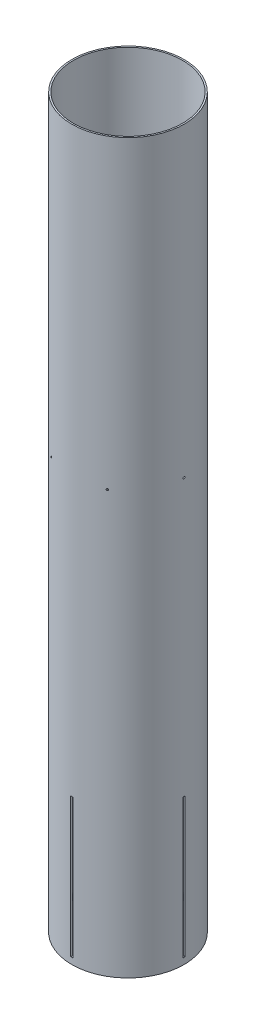
from build123d import *

# Parameters (mm, degrees)
SKETCH1_R           = 78.359
SKETCH1_R_2         = 76.2
BOSS_EXTRUDE1_DEPTH = 1016
CUT_EXTRUDE1_DEPTH  = 1023.025570014
CIRPATTERN1_COUNT   = 4
CUT_EXTRUDE2_DEPTH  = 1023.025570014
CIRPATTERN2_COUNT   = 6
SKETCH3_R           = 3.175
CUT_EXTRUDE3_DEPTH  = 1023.025570129


with BuildPart() as part:
    # Sketch1 → Boss-Extrude1 (new body)
    with BuildSketch(Plane(origin=(0, 0, 0), x_dir=(1, 0, 0), z_dir=(0, 1, 0))):
        Circle(SKETCH1_R)
        Circle(SKETCH1_R_2, mode=Mode.SUBTRACT)
    extrude(amount=BOSS_EXTRUDE1_DEPTH)

    # Sketch2 → Cut-Extrude1 (cut, through all)
    with BuildSketch(Plane(origin=(0, 0, 0), x_dir=(0, 0, -1), z_dir=(1, 0, 0))):
        Polygon((0, 8.89), (1.5875, 8.89), (1.5875, 203.2), (-1.5875, 203.2), (-1.5875, 8.89), align=None)
    cut_extrude1 = extrude(amount=-CUT_EXTRUDE1_DEPTH, mode=Mode.SUBTRACT)

    # CirPattern1: Cut-Extrude1 ×4 about axis
    cirpattern1_axis = Axis((0, 0, 0), (0, 1, 0))
    for i in range(1, CIRPATTERN1_COUNT):
        add(cut_extrude1.rotate(cirpattern1_axis, i * 360 / CIRPATTERN1_COUNT), mode=Mode.SUBTRACT)

    # Sketch2<3> → Cut-Extrude2 (cut, through all)
    with BuildSketch(Plane(origin=(0, 0, 0), x_dir=(0, 0, -1), z_dir=(1, 0, 0))):
        with BuildLine():
            ThreePointArc((0, 589.99755), (-0.956397277, 587.688602723), (1.35255, 588.645))
            ThreePointArc((1.35255, 588.645), (0.956397277, 589.601397277), (0, 589.99755))
        make_face()
    cut_extrude2 = extrude(amount=-CUT_EXTRUDE2_DEPTH, mode=Mode.SUBTRACT)

    # CirPattern2: Cut-Extrude2 ×6 about axis
    cirpattern2_axis = Axis((0, 1016, 0), (0, -1, 0))
    for i in range(1, CIRPATTERN2_COUNT):
        add(cut_extrude2.rotate(cirpattern2_axis, i * 360 / CIRPATTERN2_COUNT), mode=Mode.SUBTRACT)

    # Sketch3 → Cut-Extrude3 (cut, through all)
    with BuildSketch(Plane(origin=(0, 0, 0), x_dir=(0.7071067811865477, 0, -0.7071067811865475), z_dir=(0.7071067811865475, 0, 0.7071067811865477))):
        with Locations((0, 127)):
            Circle(SKETCH3_R)
    extrude(amount=-CUT_EXTRUDE3_DEPTH, mode=Mode.SUBTRACT)


solid = part.part
